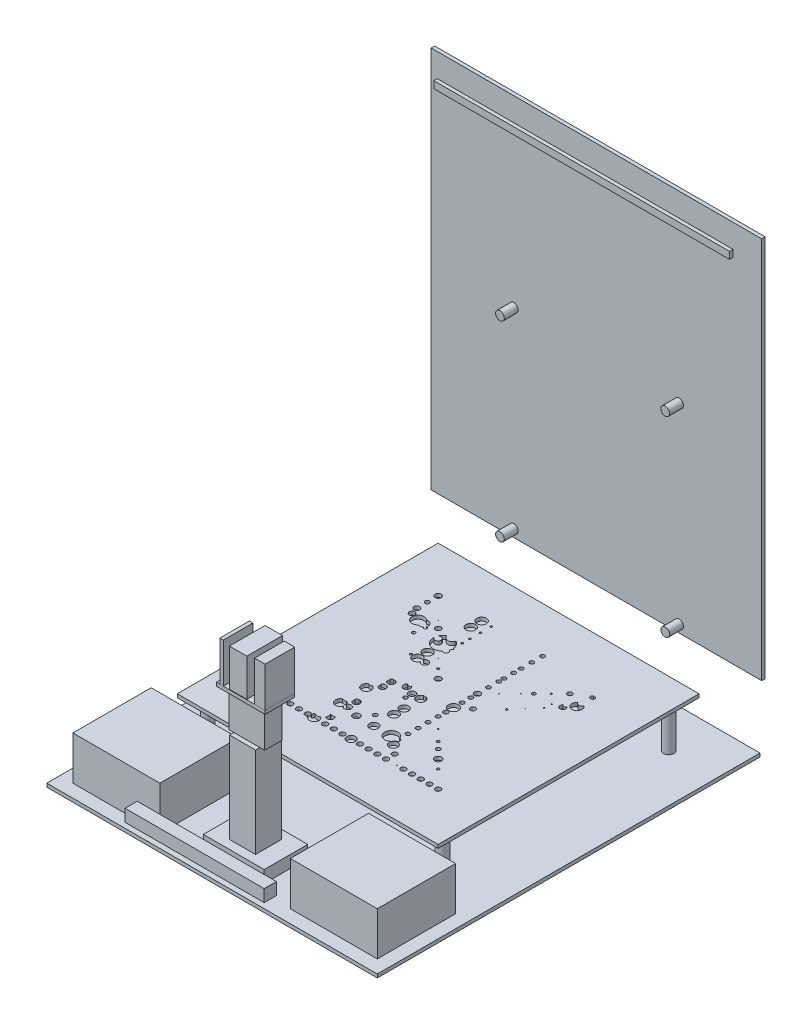
from build123d import *

# Parameters (mm, degrees)
CROQUIS1_W                     = 380
CROQUIS1_H                     = 440
SALIENTE_EXTRUIR1_DEPTH        = 4
SALIENTE_EXTRUIR3_START        = 4
CROQUIS3_R                     = 6
SALIENTE_EXTRUIR3_DEPTH        = 50
SALIENTE_EXTRUIR4_START        = 4
CROQUIS4_R                     = 6
SALIENTE_EXTRUIR4_DEPTH        = 50
SALIENTE_EXTRUIR5_START        = 4
CROQUIS5_R                     = 6
SALIENTE_EXTRUIR5_DEPTH        = 50
SALIENTE_EXTRUIR6_START        = 4
CROQUIS6_R                     = 6
SALIENTE_EXTRUIR6_DEPTH        = 50
SALIENTE_EXTRUIR7_START        = 54
SALIENTE_EXTRUIR7_OUTLINE_W    = 300
SALIENTE_EXTRUIR7_OUTLINE_H    = 300
SALIENTE_EXTRUIR7_OUTLINE_R    = 3
SALIENTE_EXTRUIR7_OUTLINE_R_2  = 5
SALIENTE_EXTRUIR7_OUTLINE_R_3  = 3.947368421
SALIENTE_EXTRUIR7_OUTLINE_R_4  = 2.368421053
SALIENTE_EXTRUIR7_OUTLINE_R_5  = 5.284496218
SALIENTE_EXTRUIR7_OUTLINE_R_6  = 5.061943174
SALIENTE_EXTRUIR7_OUTLINE_R_7  = 2.924088894
SALIENTE_EXTRUIR7_OUTLINE_R_8  = 4.946745562
SALIENTE_EXTRUIR7_OUTLINE_R_9  = 0.5
SALIENTE_EXTRUIR7_OUTLINE_R_10 = 2.431769922
SALIENTE_EXTRUIR7_OUTLINE_R_11 = 1.710526316
SALIENTE_EXTRUIR7_OUTLINE_R_12 = 0.789473684
SALIENTE_EXTRUIR7_OUTLINE_R_13 = 2.432594918
SALIENTE_EXTRUIR7_OUTLINE_R_14 = 2.682182383
SALIENTE_EXTRUIR7_OUTLINE_R_15 = 5.796539695
SALIENTE_EXTRUIR7_OUTLINE_R_16 = 1.515598499
SALIENTE_EXTRUIR7_OUTLINE_R_17 = 3.268099352
SALIENTE_EXTRUIR7_OUTLINE_R_18 = 0.263157895
SALIENTE_EXTRUIR7_OUTLINE_R_19 = 1.315789474
SALIENTE_EXTRUIR7_OUTLINE_R_20 = 5.5
SALIENTE_EXTRUIR7_OUTLINE_R_21 = 3.463801297
SALIENTE_EXTRUIR7_OUTLINE_R_22 = 1.842105263
SALIENTE_EXTRUIR7_OUTLINE_R_23 = 3.157894737
SALIENTE_EXTRUIR7_OUTLINE_R_24 = 0.293989411
SALIENTE_EXTRUIR7_OUTLINE_R_25 = 1.158426066
SALIENTE_EXTRUIR7_OUTLINE_R_26 = 2.473372781
SALIENTE_EXTRUIR7_OUTLINE_R_27 = 3.497877332
SALIENTE_EXTRUIR7_OUTLINE_R_28 = 3.439042005
SALIENTE_EXTRUIR7_OUTLINE_R_29 = 1.115980449
SALIENTE_EXTRUIR7_OUTLINE_R_30 = 0.453372187
SALIENTE_EXTRUIR7_OUTLINE_R_31 = 1.96079198
SALIENTE_EXTRUIR7_OUTLINE_R_32 = 0.882375941
SALIENTE_EXTRUIR7_OUTLINE_R_33 = 0.657894737
SALIENTE_EXTRUIR7_OUTLINE_R_34 = 2.793989411
SALIENTE_EXTRUIR7_DEPTH        = 4
SALIENTE_EXTRUIR8_START        = -226
CROQUIS8_W                     = 380
CROQUIS8_H                     = 440
SALIENTE_EXTRUIR8_DEPTH        = 4
SALIENTE_EXTRUIR10_START       = -222
CROQUIS10_R                    = 5
SALIENTE_EXTRUIR10_DEPTH       = 16
SALIENTE_EXTRUIR11_START       = -222
CROQUIS11_R                    = 5
SALIENTE_EXTRUIR11_DEPTH       = 16
SALIENTE_EXTRUIR12_START       = -222
CROQUIS12_R                    = 5
SALIENTE_EXTRUIR12_DEPTH       = 16
SALIENTE_EXTRUIR13_START       = -222
CROQUIS13_R                    = 5
SALIENTE_EXTRUIR13_DEPTH       = 16
SALIENTE_EXTRUIR15_START       = -209
CROQUIS15_W                    = 340
CROQUIS15_H                    = 8
SALIENTE_EXTRUIR15_DEPTH       = 4
SALIENTE_EXTRUIR16_START       = 4
CROQUIS16_W                    = 70
CROQUIS16_H                    = 50
SALIENTE_EXTRUIR16_DEPTH       = 14
SALIENTE_EXTRUIR17_START       = 18
CROQUIS17_W                    = 30
CROQUIS17_H                    = 30
SALIENTE_EXTRUIR17_DEPTH       = 104
SALIENTE_EXTRUIR18_START       = 122
CROQUIS18_W                    = 41
CROQUIS18_H                    = 20
SALIENTE_EXTRUIR18_DEPTH       = 43
SALIENTE_EXTRUIR19_START       = 165
CROQUIS19_W                    = 56
CROQUIS19_H                    = 34
SALIENTE_EXTRUIR19_DEPTH       = 4
SALIENTE_EXTRUIR20_START       = 169
CROQUIS20_W                    = 4
CROQUIS20_H                    = 34
SALIENTE_EXTRUIR20_DEPTH       = 46
SALIENTE_EXTRUIR21_START       = 169
CROQUIS21_W                    = 12
CROQUIS21_H                    = 34
SALIENTE_EXTRUIR21_DEPTH       = 46
SALIENTE_EXTRUIR22_START       = 149
CROQUIS22_W                    = 20
CROQUIS22_H                    = 43
SALIENTE_EXTRUIR22_DEPTH       = 41
SALIENTE_EXTRUIR23_START       = 4
CROQUIS24_W                    = 100
CROQUIS24_H                    = 90
SALIENTE_EXTRUIR23_DEPTH       = 50
SALIENTE_EXTRUIR24_START       = 4
CROQUIS25_W                    = 100
CROQUIS25_H                    = 90
SALIENTE_EXTRUIR24_DEPTH       = 50
SALIENTE_EXTRUIR25_START       = 30
CROQUIS26_W                    = 160
CROQUIS26_H                    = 14
SALIENTE_EXTRUIR25_DEPTH       = 14


with BuildPart() as part:
    # Croquis1 → Saliente-Extruir1 (new body)
    with BuildSketch(Plane(origin=(0, 0, 0), x_dir=(1, 0, 0), z_dir=(0, 1, 0))):
        Rectangle(CROQUIS1_W, CROQUIS1_H)
    extrude(amount=SALIENTE_EXTRUIR1_DEPTH)


with BuildPart() as body_2:
    # Croquis3 → Saliente-Extruir3 (new body)
    with BuildSketch(Plane(origin=(0, 0, 0), x_dir=(1, 0, 0), z_dir=(0, 1, 0)).offset(SALIENTE_EXTRUIR3_START)):
        with Locations(Location((-135, -90, 0), (0, 0, 270))):
            Circle(CROQUIS3_R)
    extrude(amount=SALIENTE_EXTRUIR3_DEPTH)


with BuildPart() as body_3:
    # Croquis4 → Saliente-Extruir4 (new body)
    with BuildSketch(Plane(origin=(0, 0, 0), x_dir=(1, 0, 0), z_dir=(0, 1, 0)).offset(SALIENTE_EXTRUIR4_START)):
        with Locations(Location((135, -90, 0), (0, 0, 270))):
            Circle(CROQUIS4_R)
    extrude(amount=SALIENTE_EXTRUIR4_DEPTH)


with BuildPart() as body_4:
    # Croquis5 → Saliente-Extruir5 (new body)
    with BuildSketch(Plane(origin=(0, 0, 0), x_dir=(1, 0, 0), z_dir=(0, 1, 0)).offset(SALIENTE_EXTRUIR5_START)):
        with Locations(Location((-135, 170, 0), (0, 0, 270))):
            Circle(CROQUIS5_R)
    extrude(amount=SALIENTE_EXTRUIR5_DEPTH)


with BuildPart() as body_5:
    # Croquis6 → Saliente-Extruir6 (new body)
    with BuildSketch(Plane(origin=(0, 0, 0), x_dir=(1, 0, 0), z_dir=(0, 1, 0)).offset(SALIENTE_EXTRUIR6_START)):
        with Locations(Location((135, 170, 0), (0, 0, 270))):
            Circle(CROQUIS6_R)
    extrude(amount=SALIENTE_EXTRUIR6_DEPTH)


with BuildPart() as body_6:
    # Saliente-Extruir7: read off the stored shape, not the designer's step
    # Saliente-Extruir7 outline → Saliente-Extruir7 (new body)
    with BuildSketch(Plane(origin=(0, 0, 0), x_dir=(1, 0, 0), z_dir=(0, 1, 0)).offset(SALIENTE_EXTRUIR7_START)):
        with Locations((0, 40)):
            Rectangle(SALIENTE_EXTRUIR7_OUTLINE_W, SALIENTE_EXTRUIR7_OUTLINE_H)
        with Locations((-95, -55)):
            Circle(SALIENTE_EXTRUIR7_OUTLINE_R, mode=Mode.SUBTRACT)
        with Locations((-85, -55)):
            Circle(SALIENTE_EXTRUIR7_OUTLINE_R, mode=Mode.SUBTRACT)
        with Locations((-75, -55)):
            Circle(SALIENTE_EXTRUIR7_OUTLINE_R, mode=Mode.SUBTRACT)
        with Locations((-65, -55)):
            Circle(SALIENTE_EXTRUIR7_OUTLINE_R, mode=Mode.SUBTRACT)
        with BuildLine():
            ThreePointArc((-44.168772534, -50.623594675), (-44.237264406, -59.427703292), (-52.666666667, -56.885618083))
            ThreePointArc((-52.666666667, -56.885618083), (-58, -55), (-52.666666667, -53.114381917))
            ThreePointArc((-52.666666667, -53.114381917), (-51.927703292, -51.737264406), (-50.831227466, -50.623594675))
            ThreePointArc((-50.831227466, -50.623594675), (-47.5, -51.536198703), (-44.168772534, -50.623594675))
        make_face(mode=Mode.SUBTRACT)
        with BuildLine():
            ThreePointArc((-41.572679851, -47.754772102), (-40.963801297, -45), (-41.572679851, -42.245227898))
            ThreePointArc((-41.572679851, -42.245227898), (-41.430200537, -42.112018993), (-41.281180032, -41.986170449))
            ThreePointArc((-41.281180032, -41.986170449), (-38.863636363, -42.735990646), (-36.446092695, -41.986170449))
            ThreePointArc((-36.446092695, -41.986170449), (-35.975655357, -47.566564173), (-41.572679851, -47.754772102))
        make_face(mode=Mode.SUBTRACT)
        with Locations((-35, -55)):
            Circle(SALIENTE_EXTRUIR7_OUTLINE_R, mode=Mode.SUBTRACT)
        with Locations((-25, -55)):
            Circle(SALIENTE_EXTRUIR7_OUTLINE_R, mode=Mode.SUBTRACT)
        with Locations((-15, -55)):
            Circle(SALIENTE_EXTRUIR7_OUTLINE_R, mode=Mode.SUBTRACT)
        with Locations((-5, -55)):
            Circle(SALIENTE_EXTRUIR7_OUTLINE_R_2, mode=Mode.SUBTRACT)
        with BuildLine():
            ThreePointArc((-45.208712153, -20), (-43.419848962, -21.311861241), (-42.294736842, -23.223701754))
            ThreePointArc((-42.294736842, -23.223701754), (-35, -25), (-42.294736842, -26.776298246))
            ThreePointArc((-42.294736842, -26.776298246), (-51.188138759, -29.080151038), (-49.791287847, -20))
            ThreePointArc((-49.791287847, -20), (-47.5, -20.5), (-45.208712153, -20))
        make_face(mode=Mode.SUBTRACT)
        with BuildLine():
            ThreePointArc((-42.294736842, -16.776298246), (-42, -15), (-42.294736842, -13.223701754))
            ThreePointArc((-42.294736842, -13.223701754), (-41.257171241, -11.967067963), (-39.793790088, -11.25))
            ThreePointArc((-39.793790088, -11.25), (-38.863636364, -11.363636364), (-37.93348264, -11.25))
            ThreePointArc((-37.93348264, -11.25), (-35.830704327, -17.393534877), (-42.294736842, -16.776298246))
        make_face(mode=Mode.SUBTRACT)
        with Locations((-25, -28.947368421)):
            Circle(SALIENTE_EXTRUIR7_OUTLINE_R_3, mode=Mode.SUBTRACT)
        with Locations((-5, -28.947368421)):
            Circle(SALIENTE_EXTRUIR7_OUTLINE_R_2, mode=Mode.SUBTRACT)
        with Locations((-15, -17.368421053)):
            Circle(SALIENTE_EXTRUIR7_OUTLINE_R_4, mode=Mode.SUBTRACT)
        with Locations((-5, -5.789473684)):
            Circle(SALIENTE_EXTRUIR7_OUTLINE_R_5, mode=Mode.SUBTRACT)
        with BuildLine():
            ThreePointArc((-49.791287847, 10), (-47.5, 9.5), (-45.208712153, 10))
            ThreePointArc((-45.208712153, 10), (-47.5, -0.5), (-49.791287847, 10))
        make_face(mode=Mode.SUBTRACT)
        with BuildLine():
            ThreePointArc((-42.294736842, 13.223701754), (-42, 15), (-42.294736842, 16.776298246))
            ThreePointArc((-42.294736842, 16.776298246), (-35, 15), (-42.294736842, 13.223701754))
        make_face(mode=Mode.SUBTRACT)
        with BuildLine():
            ThreePointArc((-40.239679527, 28.610289623), (-38.863636363, 28.463801297), (-37.4875932, 28.610289623))
            ThreePointArc((-37.4875932, 28.610289623), (-35.980990468, 22.427445124), (-42.294736842, 23.223701754))
            ThreePointArc((-42.294736842, 23.223701754), (-42, 25), (-42.294736842, 26.776298246))
            ThreePointArc((-42.294736842, 26.776298246), (-41.43619124, 27.882645895), (-40.239679527, 28.610289623))
        make_face(mode=Mode.SUBTRACT)
        with Locations((-5, 5.789473684)):
            Circle(SALIENTE_EXTRUIR7_OUTLINE_R_6, mode=Mode.SUBTRACT)
        with Locations((-15, 17.368421053)):
            Circle(SALIENTE_EXTRUIR7_OUTLINE_R_4, mode=Mode.SUBTRACT)
        with BuildLine():
            ThreePointArc((-27.029029094, 32.333333333), (-25, 30.789473684), (-22.970970906, 32.333333333))
            ThreePointArc((-22.970970906, 32.333333333), (-25, 25), (-27.029029094, 32.333333333))
        make_face(mode=Mode.SUBTRACT)
        with Locations((-15, 25)):
            Circle(SALIENTE_EXTRUIR7_OUTLINE_R_3, mode=Mode.SUBTRACT)
        with BuildLine():
            ThreePointArc((-6.472058754, 29.778393352), (-5, 29.574861019), (-3.527941246, 29.778393352))
            ThreePointArc((-3.527941246, 29.778393352), (-5, 20), (-6.472058754, 29.778393352))
        make_face(mode=Mode.SUBTRACT)
        with Locations((5, -55)):
            Circle(SALIENTE_EXTRUIR7_OUTLINE_R, mode=Mode.SUBTRACT)
        with Locations((15, -55)):
            Circle(SALIENTE_EXTRUIR7_OUTLINE_R, mode=Mode.SUBTRACT)
        with Locations((25, -55)):
            Circle(SALIENTE_EXTRUIR7_OUTLINE_R, mode=Mode.SUBTRACT)
        with Locations((35, -55)):
            Circle(SALIENTE_EXTRUIR7_OUTLINE_R, mode=Mode.SUBTRACT)
        with Locations((35, -45)):
            Circle(SALIENTE_EXTRUIR7_OUTLINE_R_7, mode=Mode.SUBTRACT)
        with Locations((25, -36.515598499)):
            Circle(SALIENTE_EXTRUIR7_OUTLINE_R_8, mode=Mode.SUBTRACT)
        with Locations((47.5, -55)):
            Circle(SALIENTE_EXTRUIR7_OUTLINE_R_9, mode=Mode.SUBTRACT)
        with Locations((55, -55)):
            Circle(SALIENTE_EXTRUIR7_OUTLINE_R, mode=Mode.SUBTRACT)
        with Locations((65, -55)):
            Circle(SALIENTE_EXTRUIR7_OUTLINE_R, mode=Mode.SUBTRACT)
        with Locations((75, -55)):
            Circle(SALIENTE_EXTRUIR7_OUTLINE_R, mode=Mode.SUBTRACT)
        with Locations((85, -55)):
            Circle(SALIENTE_EXTRUIR7_OUTLINE_R, mode=Mode.SUBTRACT)
        with Locations((95, -55)):
            Circle(SALIENTE_EXTRUIR7_OUTLINE_R, mode=Mode.SUBTRACT)
        with BuildLine():
            ThreePointArc((22.17755056, -31.347550595), (7.431769922, -28.947368421), (22.17755056, -26.547186247))
            ThreePointArc((22.17755056, -26.547186247), (25, -28.947368421), (22.17755056, -31.347550595))
        make_face(mode=Mode.SUBTRACT)
        with Locations((22.568230078, -17.368421053)):
            Circle(SALIENTE_EXTRUIR7_OUTLINE_R_10, mode=Mode.SUBTRACT)
        with Locations((22.568230078, -5.789473684)):
            Circle(SALIENTE_EXTRUIR7_OUTLINE_R_10, mode=Mode.SUBTRACT)
        with Locations((65, -25)):
            Circle(SALIENTE_EXTRUIR7_OUTLINE_R_3, mode=Mode.SUBTRACT)
        with Locations((55, -15)):
            Circle(SALIENTE_EXTRUIR7_OUTLINE_R_4, mode=Mode.SUBTRACT)
        with Locations((47.5, -7.5)):
            Circle(SALIENTE_EXTRUIR7_OUTLINE_R_11, mode=Mode.SUBTRACT)
        with Locations((22.568230078, 5.789473684)):
            Circle(SALIENTE_EXTRUIR7_OUTLINE_R_10, mode=Mode.SUBTRACT)
        with Locations((35, 5)):
            Circle(SALIENTE_EXTRUIR7_OUTLINE_R_12, mode=Mode.SUBTRACT)
        with Locations((22.568230078, 17.431769922)):
            Circle(SALIENTE_EXTRUIR7_OUTLINE_R_13, mode=Mode.SUBTRACT)
        with Locations((22.568230078, 26.131634827)):
            Circle(SALIENTE_EXTRUIR7_OUTLINE_R_14, mode=Mode.SUBTRACT)
        with Locations((22.568230078, 35)):
            Circle(SALIENTE_EXTRUIR7_OUTLINE_R_15, mode=Mode.SUBTRACT)
        with Locations((75, -35)):
            Circle(SALIENTE_EXTRUIR7_OUTLINE_R_16, mode=Mode.SUBTRACT)
        with Locations((-95, 105)):
            Circle(SALIENTE_EXTRUIR7_OUTLINE_R_17, mode=Mode.SUBTRACT)
        with Locations((-97.473372781, 112.863905325)):
            Circle(SALIENTE_EXTRUIR7_OUTLINE_R_17, mode=Mode.SUBTRACT)
        with BuildLine():
            ThreePointArc((-74.952364556, 98.004843706), (-77.356632934, 96.90672488), (-79.984817814, 97.187822067))
            ThreePointArc((-79.984817814, 97.187822067), (-91.842105263, 101.842105263), (-79.984817814, 106.496388459))
            ThreePointArc((-79.984817814, 106.496388459), (-74.709677633, 105.462850878), (-73.420028692, 100.244411507))
            ThreePointArc((-73.420028692, 100.244411507), (-71.637591888, 97.380845418), (-74.952364556, 98.004843706))
        make_face(mode=Mode.SUBTRACT)
        with Locations((-65, 75.263157895)):
            Circle(SALIENTE_EXTRUIR7_OUTLINE_R_18, mode=Mode.SUBTRACT)
        with Locations((-55, 63.684210526)):
            Circle(SALIENTE_EXTRUIR7_OUTLINE_R_19, mode=Mode.SUBTRACT)
        with BuildLine():
            ThreePointArc((-42.294736842, 61.907912281), (-53, 63.684210526), (-42.294736842, 65.460508772))
            ThreePointArc((-42.294736842, 65.460508772), (-35, 63.684210526), (-42.294736842, 61.907912281))
        make_face(mode=Mode.SUBTRACT)
        with Locations((-47.5, 75.263157895)):
            Circle(SALIENTE_EXTRUIR7_OUTLINE_R_20, mode=Mode.SUBTRACT)
        with Locations((-15, 55)):
            Circle(SALIENTE_EXTRUIR7_OUTLINE_R_21, mode=Mode.SUBTRACT)
        with Locations((-25, 65)):
            Circle(SALIENTE_EXTRUIR7_OUTLINE_R_19, mode=Mode.SUBTRACT)
        with Locations((-35.263157895, 75.263157895)):
            Circle(SALIENTE_EXTRUIR7_OUTLINE_R_18, mode=Mode.SUBTRACT)
        with Locations((-75, 86.842105263)):
            Circle(SALIENTE_EXTRUIR7_OUTLINE_R_22, mode=Mode.SUBTRACT)
        with BuildLine():
            ThreePointArc((-52.891423463, 102.717216853), (-47.5, 98.547293072), (-42.108576537, 102.717216853))
            ThreePointArc((-42.108576537, 102.717216853), (-38.255075096, 99.143523335), (-36.482149972, 94.196049715))
            ThreePointArc((-36.482149972, 94.196049715), (-35.263157895, 93.03920802), (-36.482149972, 91.882366324))
            ThreePointArc((-36.482149972, 91.882366324), (-36.652090371, 90.791062426), (-36.929847924, 89.722102801))
            ThreePointArc((-36.929847924, 89.722102801), (-35.697651027, 85.448684938), (-40.097201223, 84.797249987))
            ThreePointArc((-40.097201223, 84.797249987), (-52.852111768, 83.339403817), (-58.419793824, 94.907202873))
            ThreePointArc((-58.419793824, 94.907202873), (-51.690191137, 94.13468711), (-57.936797261, 96.754657503))
            ThreePointArc((-57.936797261, 96.754657503), (-55.957019057, 100.195333411), (-52.891423463, 102.717216853))
        make_face(mode=Mode.SUBTRACT)
        with Locations((-65, 105)):
            Circle(SALIENTE_EXTRUIR7_OUTLINE_R_23, mode=Mode.SUBTRACT)
        with Locations((-72.863905325, 112.863905325)):
            Circle(SALIENTE_EXTRUIR7_OUTLINE_R_24, mode=Mode.SUBTRACT)
        with Locations((-36.421583961, 104.117624059)):
            Circle(SALIENTE_EXTRUIR7_OUTLINE_R_25, mode=Mode.SUBTRACT)
        with Locations((-36.421583961, 112.863905325)):
            Circle(SALIENTE_EXTRUIR7_OUTLINE_R_25, mode=Mode.SUBTRACT)
        with Locations((-97.473372781, 125)):
            Circle(SALIENTE_EXTRUIR7_OUTLINE_R_26, mode=Mode.SUBTRACT)
        with Locations((-97.473372781, 137.473372781)):
            Circle(SALIENTE_EXTRUIR7_OUTLINE_R_27, mode=Mode.SUBTRACT)
        with Locations((-47.5, 125)):
            Circle(SALIENTE_EXTRUIR7_OUTLINE_R_20, mode=Mode.SUBTRACT)
        with Locations((-47.5, 137.473372781)):
            Circle(SALIENTE_EXTRUIR7_OUTLINE_R_20, mode=Mode.SUBTRACT)
        with Locations((-36.421583961, 125)):
            Circle(SALIENTE_EXTRUIR7_OUTLINE_R_25, mode=Mode.SUBTRACT)
        with Locations((-36.421583961, 137.473372781)):
            Circle(SALIENTE_EXTRUIR7_OUTLINE_R_25, mode=Mode.SUBTRACT)
        with Locations((22.568230078, 45)):
            Circle(SALIENTE_EXTRUIR7_OUTLINE_R_10, mode=Mode.SUBTRACT)
        with Locations((35, 45)):
            Circle(SALIENTE_EXTRUIR7_OUTLINE_R_7, mode=Mode.SUBTRACT)
        with Locations((22.568230078, 55)):
            Circle(SALIENTE_EXTRUIR7_OUTLINE_R_10, mode=Mode.SUBTRACT)
        with Locations((22.568230078, 62.568230078)):
            Circle(SALIENTE_EXTRUIR7_OUTLINE_R_28, mode=Mode.SUBTRACT)
        with Locations((22.568230078, 75.263157895)):
            Circle(SALIENTE_EXTRUIR7_OUTLINE_R_10, mode=Mode.SUBTRACT)
        with Locations((35, 75)):
            Circle(SALIENTE_EXTRUIR7_OUTLINE_R_18, mode=Mode.SUBTRACT)
        with Locations((55, 63.684210526)):
            Circle(SALIENTE_EXTRUIR7_OUTLINE_R_29, mode=Mode.SUBTRACT)
        with Locations((65, 75.263157895)):
            Circle(SALIENTE_EXTRUIR7_OUTLINE_R_18, mode=Mode.SUBTRACT)
        with Locations((22.568230078, 87.046627813)):
            Circle(SALIENTE_EXTRUIR7_OUTLINE_R_10, mode=Mode.SUBTRACT)
        with Locations((22.568230078, 93.03920802)):
            Circle(SALIENTE_EXTRUIR7_OUTLINE_R_10, mode=Mode.SUBTRACT)
        with Locations((22.568230078, 104.117624059)):
            Circle(SALIENTE_EXTRUIR7_OUTLINE_R_10, mode=Mode.SUBTRACT)
        with Locations((22.568230078, 112.863905325)):
            Circle(SALIENTE_EXTRUIR7_OUTLINE_R_10, mode=Mode.SUBTRACT)
        with Locations((47.5, 87.5)):
            Circle(SALIENTE_EXTRUIR7_OUTLINE_R_30, mode=Mode.SUBTRACT)
        with Locations((55, 95)):
            Circle(SALIENTE_EXTRUIR7_OUTLINE_R_31, mode=Mode.SUBTRACT)
        with Locations((65, 105)):
            Circle(SALIENTE_EXTRUIR7_OUTLINE_R_32, mode=Mode.SUBTRACT)
        with Locations((75, 86.842105263)):
            Circle(SALIENTE_EXTRUIR7_OUTLINE_R_33, mode=Mode.SUBTRACT)
        with Locations((75.657894737, 95)):
            Circle(SALIENTE_EXTRUIR7_OUTLINE_R_33, mode=Mode.SUBTRACT)
        with BuildLine():
            ThreePointArc((82.763932023, 101.010183974), (85, 99.456294493), (87.236067977, 101.010183974))
            ThreePointArc((87.236067977, 101.010183974), (85, 95), (82.763932023, 101.010183974))
        make_face(mode=Mode.SUBTRACT)
        with BuildLine():
            ThreePointArc((89.062753557, 111.841992682), (92.526627219, 109.333545688), (95.990500881, 111.841992682))
            ThreePointArc((95.990500881, 111.841992682), (92.526627219, 101.292816759), (89.062753557, 111.841992682))
        make_face(mode=Mode.SUBTRACT)
        with Locations((22.568230078, 125)):
            Circle(SALIENTE_EXTRUIR7_OUTLINE_R_10, mode=Mode.SUBTRACT)
        with Locations((22.568230078, 137.473372781)):
            Circle(SALIENTE_EXTRUIR7_OUTLINE_R_10, mode=Mode.SUBTRACT)
        with Locations((75.657894737, 115.657894737)):
            Circle(SALIENTE_EXTRUIR7_OUTLINE_R_34, mode=Mode.SUBTRACT)
        with BuildLine():
            ThreePointArc((91.282571647, 127.137732128), (92.526627218, 126.995997547), (93.77068279, 127.137732128))
            ThreePointArc((93.77068279, 127.137732128), (92.526627218, 122.526627219), (91.282571647, 127.137732128))
        make_face(mode=Mode.SUBTRACT)
    extrude(amount=SALIENTE_EXTRUIR7_DEPTH)


with BuildPart() as body_7:
    # Croquis8 → Saliente-Extruir8 (new body)
    with BuildSketch(Plane.XY.offset(SALIENTE_EXTRUIR8_START)):
        with Locations((0, 295)):
            Rectangle(CROQUIS8_W, CROQUIS8_H)
    extrude(amount=SALIENTE_EXTRUIR8_DEPTH)


with BuildPart() as body_8:
    # Croquis10 → Saliente-Extruir10 (new body)
    with BuildSketch(Plane.XY.offset(SALIENTE_EXTRUIR10_START)):
        with Locations((-95, 84)):
            Circle(CROQUIS10_R)
    extrude(amount=SALIENTE_EXTRUIR10_DEPTH)


with BuildPart() as body_9:
    # Croquis11 → Saliente-Extruir11 (new body)
    with BuildSketch(Plane.XY.offset(SALIENTE_EXTRUIR11_START)):
        with Locations((95, 84)):
            Circle(CROQUIS11_R)
    extrude(amount=SALIENTE_EXTRUIR11_DEPTH)


with BuildPart() as body_10:
    # Croquis12 → Saliente-Extruir12 (new body)
    with BuildSketch(Plane.XY.offset(SALIENTE_EXTRUIR12_START)):
        with Locations((-95, 304)):
            Circle(CROQUIS12_R)
    extrude(amount=SALIENTE_EXTRUIR12_DEPTH)


with BuildPart() as body_11:
    # Croquis13 → Saliente-Extruir13 (new body)
    with BuildSketch(Plane.XY.offset(SALIENTE_EXTRUIR13_START)):
        with Locations((95, 304)):
            Circle(CROQUIS13_R)
    extrude(amount=SALIENTE_EXTRUIR13_DEPTH)


with BuildPart() as body_12:
    # Croquis15 → Saliente-Extruir15 (new body)
    with BuildSketch(Plane.XY.offset(SALIENTE_EXTRUIR15_START)):
        with Locations((0, 497)):
            Rectangle(CROQUIS15_W, CROQUIS15_H)
    extrude(amount=SALIENTE_EXTRUIR15_DEPTH)


with BuildPart() as body_13:
    # Croquis16 → Saliente-Extruir16 (new body)
    with BuildSketch(Plane(origin=(0, 0, 0), x_dir=(1, 0, 0), z_dir=(0, 1, 0)).offset(SALIENTE_EXTRUIR16_START)):
        with Locations((0, -170)):
            Rectangle(CROQUIS16_W, CROQUIS16_H)
    extrude(amount=SALIENTE_EXTRUIR16_DEPTH)


with BuildPart() as body_14:
    # Croquis17 → Saliente-Extruir17 (new body)
    with BuildSketch(Plane(origin=(0, 0, 0), x_dir=(1, 0, 0), z_dir=(0, 1, 0)).offset(SALIENTE_EXTRUIR17_START)):
        with Locations((0, -170)):
            Rectangle(CROQUIS17_W, CROQUIS17_H)
    extrude(amount=SALIENTE_EXTRUIR17_DEPTH)


with BuildPart() as body_15:
    # Croquis18 → Saliente-Extruir18 (new body)
    with BuildSketch(Plane(origin=(0, 0, 0), x_dir=(1, 0, 0), z_dir=(0, 1, 0)).offset(SALIENTE_EXTRUIR18_START)):
        with Locations((0, -170)):
            Rectangle(CROQUIS18_W, CROQUIS18_H)
    extrude(amount=SALIENTE_EXTRUIR18_DEPTH)


with BuildPart() as body_16:
    # Croquis19 → Saliente-Extruir19 (new body)
    with BuildSketch(Plane(origin=(0, 0, 0), x_dir=(1, 0, 0), z_dir=(0, 1, 0)).offset(SALIENTE_EXTRUIR19_START)):
        with Locations((0, -170)):
            Rectangle(CROQUIS19_W, CROQUIS19_H)
    extrude(amount=SALIENTE_EXTRUIR19_DEPTH)


with BuildPart() as body_17:
    # Croquis20 → Saliente-Extruir20 (new body)
    with BuildSketch(Plane(origin=(0, 0, 0), x_dir=(1, 0, 0), z_dir=(0, 1, 0)).offset(SALIENTE_EXTRUIR20_START)):
        with Locations((-22, -170)):
            Rectangle(CROQUIS20_W, CROQUIS20_H)
    extrude(amount=SALIENTE_EXTRUIR20_DEPTH)


with BuildPart() as body_18:
    # Croquis21 → Saliente-Extruir21 (new body)
    with BuildSketch(Plane(origin=(0, 0, 0), x_dir=(1, 0, 0), z_dir=(0, 1, 0)).offset(SALIENTE_EXTRUIR21_START)):
        with Locations((22, -170)):
            Rectangle(CROQUIS21_W, CROQUIS21_H)
    extrude(amount=SALIENTE_EXTRUIR21_DEPTH)


with BuildPart() as body_19:
    # Croquis22 → Saliente-Extruir22 (new body)
    with BuildSketch(Plane.XY.offset(SALIENTE_EXTRUIR22_START)):
        with Locations((0, 194)):
            Rectangle(CROQUIS22_W, CROQUIS22_H)
    extrude(amount=SALIENTE_EXTRUIR22_DEPTH)


with BuildPart() as body_20:
    # Croquis24 → Saliente-Extruir23 (new body)
    with BuildSketch(Plane(origin=(0, 0, 0), x_dir=(1, 0, 0), z_dir=(0, 1, 0)).offset(SALIENTE_EXTRUIR23_START)):
        with Locations((125, -160)):
            Rectangle(CROQUIS24_W, CROQUIS24_H)
    extrude(amount=SALIENTE_EXTRUIR23_DEPTH)


with BuildPart() as body_21:
    # Croquis25 → Saliente-Extruir24 (new body)
    with BuildSketch(Plane(origin=(0, 0, 0), x_dir=(1, 0, 0), z_dir=(0, 1, 0)).offset(SALIENTE_EXTRUIR24_START)):
        with Locations((-125, -160)):
            Rectangle(CROQUIS25_W, CROQUIS25_H)
    extrude(amount=SALIENTE_EXTRUIR24_DEPTH)


with BuildPart() as body_22:
    # Croquis26 → Saliente-Extruir25 (new body)
    with BuildSketch(Plane(origin=(0, 0, 0), x_dir=(1, 0, 0), z_dir=(0, 1, 0)).offset(SALIENTE_EXTRUIR25_START)):
        with Locations((0, -233)):
            Rectangle(CROQUIS26_W, CROQUIS26_H)
    extrude(amount=SALIENTE_EXTRUIR25_DEPTH)


solid = Compound([part.part, body_2.part, body_3.part, body_4.part, body_5.part, body_6.part, body_7.part, body_8.part, body_9.part, body_10.part, body_11.part, body_12.part, body_13.part, body_14.part, body_15.part, body_16.part, body_17.part, body_18.part, body_19.part, body_20.part, body_21.part, body_22.part])
